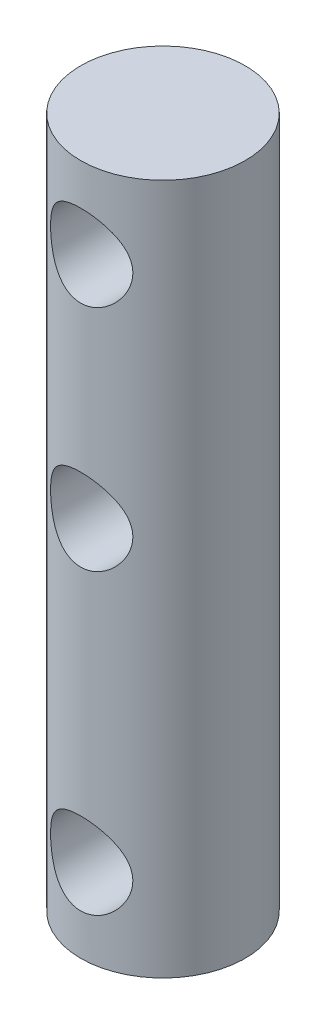
from build123d import *

# Parameters (mm, degrees)
SKETCH1_R               = 2.5
BOSS_EXTRUDE1_DEPTH     = 21
CUT_EXTRUDE1_DEPTH      = 22.295539439
CUT_EXTRUDE1_DEPTH_BACK = 22.295539439
SKETCH2_R               = 1.25


with BuildPart() as part:
    # Sketch1 → Boss-Extrude1 (new body)
    with BuildSketch(Plane(origin=(0, 0, 0), x_dir=(1, 0, 0), z_dir=(0, 1, 0))):
        Circle(SKETCH1_R)
    extrude(amount=BOSS_EXTRUDE1_DEPTH)

    # Sketch2 → Cut-Extrude1 (cut, two sides: drawn at the far end of the back side and taken through both)
    with BuildSketch(Plane.XY.offset(-CUT_EXTRUDE1_DEPTH_BACK)):
        with Locations((0, 18.5)):
            Circle(SKETCH2_R)
        with Locations((0, 2.5)):
            Circle(SKETCH2_R)
        with Locations((0, 11.55)):
            Circle(SKETCH2_R)
    extrude(amount=CUT_EXTRUDE1_DEPTH + CUT_EXTRUDE1_DEPTH_BACK, mode=Mode.SUBTRACT)


solid = part.part
